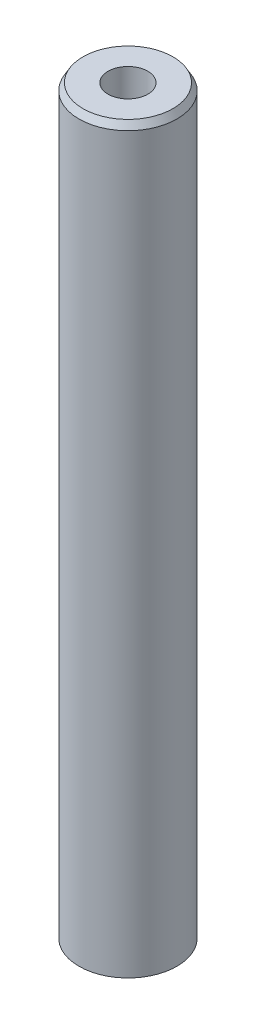
from build123d import *
from OCP.BRepFilletAPI import BRepFilletAPI_MakeChamfer

# Parameters (mm, degrees)
SKETCH1_R           = 7.5
BOSS_EXTRUDE1_DEPTH = 114.046185372
SKETCH2_R           = 3.04820137
CUT_EXTRUDE1_DEPTH  = 115.538344662
CHAMFER1_SIZE       = 1.065861607
CHAMFER1_SIZE2      = 0.615375485


with BuildPart() as part:
    # Sketch1 → Boss-Extrude1 (new body)
    with BuildSketch(Plane(origin=(0, 0, 0), x_dir=(1, 0, 0), z_dir=(0, 1, 0))):
        Circle(SKETCH1_R)
    extrude(amount=BOSS_EXTRUDE1_DEPTH)

    # Sketch2 → Cut-Extrude1 (cut, through all)
    with BuildSketch(Plane(origin=(0, 0, 0), x_dir=(1, 0, 0), z_dir=(0, 1, 0))):
        Circle(SKETCH2_R)
    extrude(amount=CUT_EXTRUDE1_DEPTH, mode=Mode.SUBTRACT)

    # Chamfer1: one chamfer whose edges measure the first distance from different faces: ONE call of the kernel's chamfer builder (chamfer() names one face for all edges)
    chamfer1_edges_1 = [part.edges().sort_by_distance(p)[0] for p in [
        (-7.5, 114.046185372, 0),
    ]]
    chamfer1_side_1 = [part.faces().sort_by_distance(p)[0] for p in [
        (-7.5, 57.023092686, 0),
    ]]
    chamfer1_edges_2 = [part.edges().sort_by_distance(p)[0] for p in [
        (-7.5, 0, 0),
    ]]
    chamfer1_side_2 = [part.faces().sort_by_distance(p)[0] for p in [
        (-7.287867966, 0, 0),
    ]]
    chamfer1 = BRepFilletAPI_MakeChamfer(part.part.solid().wrapped)
    for e in chamfer1_edges_1:
        chamfer1.Add(CHAMFER1_SIZE, CHAMFER1_SIZE2, e.wrapped, chamfer1_side_1[0].wrapped)  # the first distance lies on this face
    for e in chamfer1_edges_2:
        chamfer1.Add(CHAMFER1_SIZE, CHAMFER1_SIZE2, e.wrapped, chamfer1_side_2[0].wrapped)  # the first distance lies on this face
    add(Compound.cast(chamfer1.Shape()), mode=Mode.REPLACE)


solid = part.part
